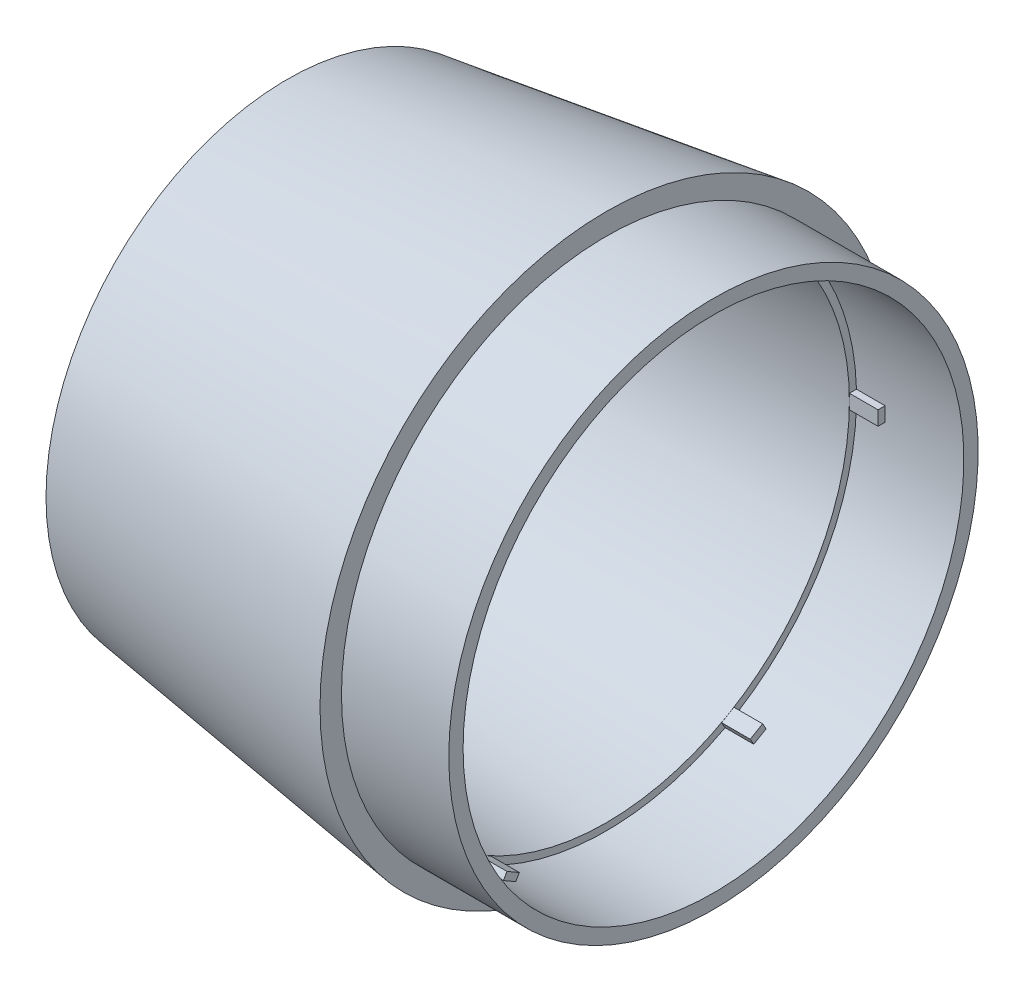
from build123d import *

# Parameters (mm, degrees)
IZIM3_W                     = 4
IZIM3_H                     = 1
Y_KSEKLIK_EKSTR_ZYON1_DEPTH = 1
DAIRESEL_KAPLAMA2_COUNT     = 6


with BuildPart() as part:
    # Çizim1 → Döndür2 (revolve)
    with BuildSketch(Plane.XY):
        Polygon((0, 40), (-44.562063093, 33.737210457), (-44.562063093, 31.737210457), (-33.555064496, 31.737210457), (0, 34), (0, 35), (15, 35), (15, 37), (0, 37), align=None)
    revolve(axis=Axis((-44.316348886, 0, 0), (1, 0, 0)))

    # Çizim3 → Yükseklik-Ekstrüzyon1 (add, symmetric)
    with BuildSketch(Plane(origin=(0, 0, 0), x_dir=(1, 0, 0), z_dir=(0, 1, 0))):
        with Locations((2, -34.5)):
            Rectangle(IZIM3_W, IZIM3_H)
    y_kseklik_ekstr_zyon1 = extrude(amount=Y_KSEKLIK_EKSTR_ZYON1_DEPTH, both=True)

    # Dairesel Kaplama2: Yükseklik-Ekstrüzyon1 ×6 about axis
    dairesel_kaplama2_axis = Axis((0, 0, 0), (-1, 0, 0))
    for i in range(1, DAIRESEL_KAPLAMA2_COUNT):
        add(y_kseklik_ekstr_zyon1.rotate(dairesel_kaplama2_axis, i * 360 / DAIRESEL_KAPLAMA2_COUNT))


solid = part.part
